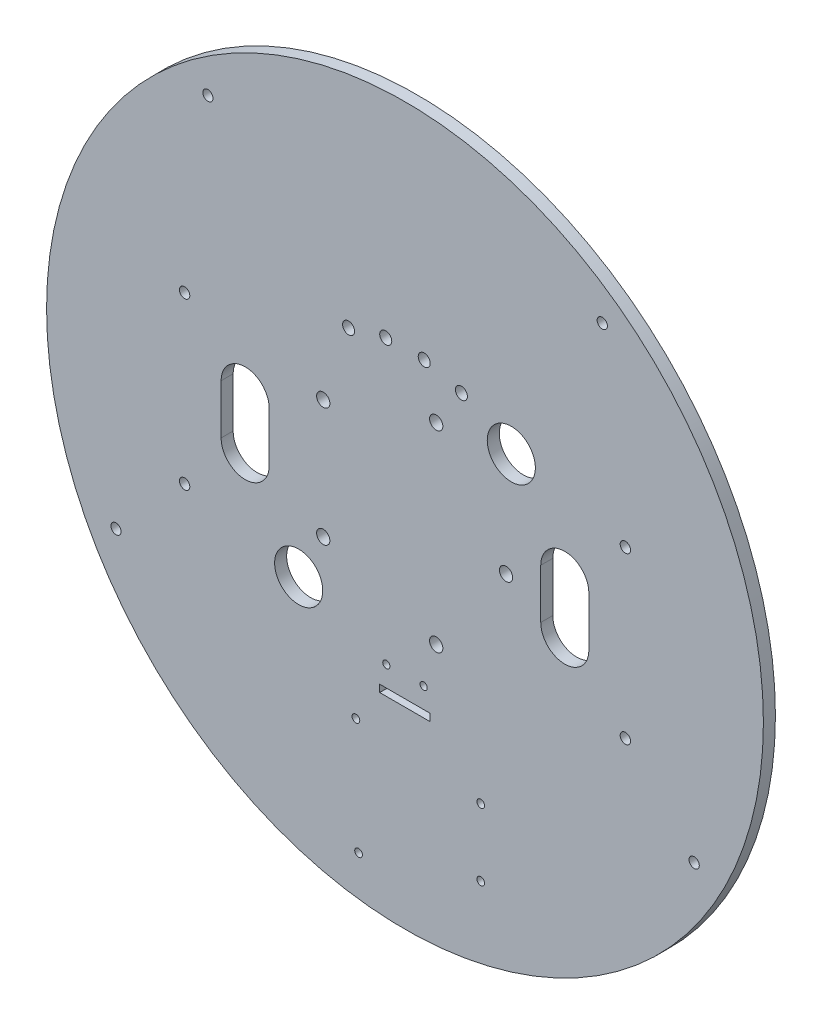
from build123d import *

# Parameters (mm, degrees)
SKETCH1_R                        = 149
PLATE_DEPTH                      = 5
SKETCH3_R                        = 2.75
TABLELEGHOLE_DEPTH               = 211.777133485
TABLELEGPATTERN_COUNT            = 5
SKETCH5_R                        = 2.15
LIDARHOLESMOUNTING_DEPTH         = 211.777133485
LIDARHOLEPOWER_DEPTH             = 211.777133485
SKETCH22_R                       = 10
CUT_EXTRUDE12_DEPTH              = 211.777133485
MULTIPLELIDARS_OUTLINE_R         = 2.15
MULTIPLELIDARS_OUTLINE_R_2       = 10
MULTIPLELIDARS_DEPTH             = 5
CUT_EXTRUDE8_DEPTH               = 211.777133485
CUT_EXTRUDE8_DEPTH_BACK          = 211.777133485
SKETCH16_R                       = 2.125
SKETCH19_R                       = 2.5
CUT_EXTRUDE9_DEPTH               = 211.777133485
CIRPATTERN19_COUNT               = 2
CIRPATTERN19_ANGLE               = 15.189286737
CIRPATTERN19_THE_OTHER_WAY_COUNT = 2
CIRPATTERN19_THE_OTHER_WAY_ANGLE = 15.189286737
CUT_EXTRUDE10_DEPTH              = 211.777133485
CUT_EXTRUDE10_DEPTH_BACK         = 211.777133485
SKETCH21_R                       = 1.5
SKETCH21_W                       = 21
SKETCH21_H                       = 3
CUT_EXTRUDE13_DEPTH              = 211.777133485
CUT_EXTRUDE13_DEPTH_BACK         = 211.777133485
SKETCH23_R                       = 1.6


# Read off the part's stored shape, not the designer's step: MultipleLIDARs
with BuildPart() as part:
    # Sketch1 → Plate (new body)
    with BuildSketch(Plane.XY):
        Circle(SKETCH1_R)
    extrude(amount=PLATE_DEPTH)

    # Sketch3 → TableLegHole (cut, symmetric)
    with BuildSketch(Plane.XY.offset(5)):
        with Locations((12.978713764, 39.944373684)):
            Circle(SKETCH3_R)
    tableleghole = extrude(amount=TABLELEGHOLE_DEPTH, both=True, mode=Mode.SUBTRACT)

    # TableLegPattern: TableLegHole ×5 about axis
    tablelegpattern_axis = Axis((0, 0, 0), (0, 0, 1))
    for i in range(1, TABLELEGPATTERN_COUNT):
        add(tableleghole.rotate(tablelegpattern_axis, i * 360 / TABLELEGPATTERN_COUNT), mode=Mode.SUBTRACT)

    # Sketch5 → LIDARHolesMounting (cut, symmetric)
    with BuildSketch(Plane.XY.offset(5)):
        with Locations((91.60600659, 34.399999999)):
            Circle(SKETCH5_R)
        with Locations((91.60600659, -34.400000001)):
            Circle(SKETCH5_R)
    extrude(amount=LIDARHOLESMOUNTING_DEPTH, both=True, mode=Mode.SUBTRACT)

    # Sketch6 → LIDARHolePower (cut, symmetric)
    with BuildSketch(Plane.XY.offset(5)):
        with BuildLine():
            Line((76.435075359, 10.29999973), (76.435075359, -10.30000027))
            ThreePointArc((76.435075359, -10.30000027), (66.435075327, -20.300000238), (56.435075359, -10.30000027))
            Line((56.435075359, -10.30000027), (56.435075359, 10.29999973))
            ThreePointArc((56.435075359, 10.29999973), (66.435075359, 20.29999973), (76.435075359, 10.29999973))
        make_face()
    extrude(amount=LIDARHOLEPOWER_DEPTH, both=True, mode=Mode.SUBTRACT)

    # Sketch22 → Cut-Extrude12 (cut, symmetric)
    with BuildSketch(Plane(origin=(0, 0, 0), x_dir=(-1, 0, 0), z_dir=(0, 0, -1))):
        with Locations((-44.194173824, 44.194173824)):
            Circle(SKETCH22_R)
    extrude(amount=CUT_EXTRUDE12_DEPTH, both=True, mode=Mode.SUBTRACT)

    # MultipleLIDARs outline → MultipleLIDARs (cut)
    with BuildSketch(Plane.XY):
        with Locations((-91.60600659, -34.399999999)):
            Circle(MULTIPLELIDARS_OUTLINE_R)
        with Locations((-91.60600659, 34.400000001)):
            Circle(MULTIPLELIDARS_OUTLINE_R)
        with BuildLine():
            Line((-76.435075327, 10.30000027), (-76.435075359, -10.29999973))
            ThreePointArc((-76.435075359, -10.29999973), (-66.435075359, -20.29999973), (-56.435075359, -10.29999973))
            Line((-56.435075359, -10.29999973), (-56.435075327, 10.30000027))
            ThreePointArc((-56.435075327, 10.30000027), (-66.435075327, 20.30000027), (-76.435075327, 10.30000027))
        make_face()
        with Locations((-44.194173824, -44.194173824)):
            Circle(MULTIPLELIDARS_OUTLINE_R_2)
    extrude(amount=MULTIPLELIDARS_DEPTH, mode=Mode.SUBTRACT)

    # Sketch16 → Cut-Extrude8 (cut, two sides: drawn at the far end of the back side and taken through both)
    with BuildSketch(Plane.XY.offset(5).offset(-CUT_EXTRUDE8_DEPTH_BACK)):
        with Locations((120.216636108, -64.855346008)):
            Circle(SKETCH16_R)
        with Locations((-120.129383426, -64.855346008)):
            Circle(SKETCH16_R)
        with Locations((-81.927723162, 110.258930177)):
            Circle(SKETCH16_R)
        with Locations((82.014955409, 110.258930177)):
            Circle(SKETCH16_R)
    extrude(amount=CUT_EXTRUDE8_DEPTH + CUT_EXTRUDE8_DEPTH_BACK, mode=Mode.SUBTRACT)

    # Sketch19 → Cut-Extrude9 (cut, symmetric)
    with BuildSketch(Plane.XY.offset(5)):
        with Locations((8, 60)):
            Circle(SKETCH19_R)
        with Locations((-8, 60)):
            Circle(SKETCH19_R)
    cut_extrude9 = extrude(amount=CUT_EXTRUDE9_DEPTH, both=True, mode=Mode.SUBTRACT)

    # CirPattern19: Cut-Extrude9 ×2 about axis
    cirpattern19_axis = Axis((0, 0, 0), (0, 0, -1))
    for i in range(1, CIRPATTERN19_COUNT):
        add(cut_extrude9.rotate(cirpattern19_axis, i * CIRPATTERN19_ANGLE / (CIRPATTERN19_COUNT - 1)), mode=Mode.SUBTRACT)

    # CirPattern19 the other way: Cut-Extrude9 ×2 about axis
    cirpattern19_the_other_way_axis = Axis((0, 0, 0), (0, 0, 1))
    for i in range(1, CIRPATTERN19_THE_OTHER_WAY_COUNT):
        add(cut_extrude9.rotate(cirpattern19_the_other_way_axis, i * CIRPATTERN19_THE_OTHER_WAY_ANGLE / (CIRPATTERN19_THE_OTHER_WAY_COUNT - 1)), mode=Mode.SUBTRACT)

    # Sketch21 → Cut-Extrude10 (cut, two sides: drawn at the far end of the back side and taken through both)
    with BuildSketch(Plane(origin=(0, 0, 0), x_dir=(-1, 0, 0), z_dir=(0, 0, -1)).offset(-CUT_EXTRUDE10_DEPTH_BACK)):
        with Locations((7.75, -57.5)):
            Circle(SKETCH21_R)
        with Locations((-7.75, -57.5)):
            Circle(SKETCH21_R)
        with Locations((0, -67.5)):
            Rectangle(SKETCH21_W, SKETCH21_H)
    extrude(amount=CUT_EXTRUDE10_DEPTH + CUT_EXTRUDE10_DEPTH_BACK, mode=Mode.SUBTRACT)

    # Sketch23 → Cut-Extrude13 (cut, two sides: drawn at the far end of the back side and taken through both)
    with BuildSketch(Plane.XY.offset(5).offset(-CUT_EXTRUDE13_DEPTH_BACK)):
        with Locations((-20.4, -83.3)):
            Circle(SKETCH23_R)
        with Locations((31.5, -88)):
            Circle(SKETCH23_R)
        with Locations((31.5, -115.9)):
            Circle(SKETCH23_R)
        with Locations((-19.3, -131.1)):
            Circle(SKETCH23_R)
    extrude(amount=CUT_EXTRUDE13_DEPTH + CUT_EXTRUDE13_DEPTH_BACK, mode=Mode.SUBTRACT)


solid = part.part
